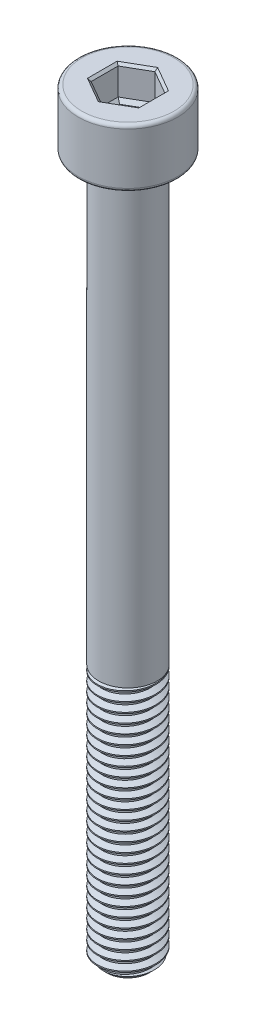
from build123d import *

# Parameters (mm, degrees)
SKETCH1_R           = 2.5
BOSS_EXTRUDE1_DEPTH = 22
THREAD1_PITCH       = 0.8
SKETCH2_R           = 2.5
BOSS_EXTRUDE2_DEPTH = 38
SKETCH3_R           = 4.25
BOSS_EXTRUDE3_DEPTH = 5
FILLET1_R           = 0.3
CUT_EXTRUDE1_DEPTH  = 2.5
CHAMFER1_SIZE       = 0.2
CUT_EXTRUDE2_DEPTH  = 0.3
CUT_EXTRUDE2_DRAFT  = -45


with BuildPart() as part:
    # Sketch1 → Boss-Extrude1 (new body)
    with BuildSketch(Plane(origin=(0, 0, 0), x_dir=(1, 0, 0), z_dir=(0, 1, 0))):
        with Locations(Location((0, 0, 0), (0, 0, 270))):
            Circle(SKETCH1_R)
    extrude(amount=BOSS_EXTRUDE1_DEPTH)

    # Thread1: arcs per turn and ends read off the stored shape
    # Thread1: the profile of Thread Profile1 profile screwed along a right-hand helix through 30 turns, 8 arcs to a turn; built about Z, then put on its axis
    thread1_z = Axis((0, 0, 0), (0, 0, 1))
    thread1_corners = [(2.5003, 0, -0.000173205), (2.5003, 0, 0.700173203), (2.0669873, 0, 0.449999999), (2.0669873, 0, 0.249999999)]
    with BuildLine(mode=Mode.PRIVATE) as thread1_profile:
        Line(thread1_corners[0], thread1_corners[1])
        Line(thread1_corners[1], thread1_corners[2])
        Line(thread1_corners[2], thread1_corners[3])
        Line(thread1_corners[3], thread1_corners[0])
    thread1_cap = Face(thread1_profile.wire())
    thread1_turn_angles = [0, 22.5, 45, 67.5, 90, 112.5, 135, 157.5, 180, 202.5, 225, 247.5, 270, 292.5, 315, 337.5, 360]
    thread1_turn_weights = [1, 0.9238795325112867, 1, 0.9238795325112867, 1, 0.9238795325112867, 1, 0.9238795325112867, 1, 0.9238795325112867, 1, 0.9238795325112867, 1, 0.9238795325112867, 1, 0.9238795325112867, 1]
    thread1_turn_rails = [Edge.make_bspline([Vector(p[0], p[1], 0).rotate(thread1_z, thread1_turn_angles[k]) / thread1_turn_weights[k] + Vector(0, 0, p[2] + THREAD1_PITCH * thread1_turn_angles[k] / 360) for k in range(17)], [0, 0, 0, 1, 1, 2, 2, 3, 3, 4, 4, 5, 5, 6, 6, 7, 7, 8, 8, 8], 2, thread1_turn_weights) for p in thread1_corners]
    thread1_turn_sides = [Face.make_surface_from_curves(thread1_turn_rails[p[0]], thread1_turn_rails[p[1]]) for p in [(0, 1), (1, 2), (2, 3), (3, 0)]]
    thread1 = Plane(origin=(0, 23, 0), x_dir=(-1, 0, 0), z_dir=(0, -1, 0)) * Solid(Shell([*[p.moved(Location((0, 0, THREAD1_PITCH * i))) for i in range(30) for p in thread1_turn_sides], thread1_cap, thread1_cap.rotate(thread1_z, 10800).moved(Location((0, 0, THREAD1_PITCH * 10800 / 360)))]))
    add(thread1, mode=Mode.SUBTRACT)

    # Sketch2 → Boss-Extrude2 (add)
    with BuildSketch(Plane(origin=(0, 22, 0), x_dir=(1, 0, 0), z_dir=(0, 1, 0))):
        with Locations(Location((0, 0, 0), (0, 0, 90))):
            Circle(SKETCH2_R)
    extrude(amount=BOSS_EXTRUDE2_DEPTH)

    # Sketch3 → Boss-Extrude3 (add)
    with BuildSketch(Plane(origin=(0, 60, 0), x_dir=(1, 0, 0), z_dir=(0, 1, 0))):
        with Locations(Location((0, 0, 0), (0, 0, 270))):
            Circle(SKETCH3_R)
    extrude(amount=BOSS_EXTRUDE3_DEPTH)

    # Fillet1
    fillet1_edges = [part.edges().sort_by_distance(p)[0] for p in [
        (0, 60, -4.25),
        (0, 65, -4.25),
    ]]
    fillet(fillet1_edges, radius=FILLET1_R)

    # Sketch4 → Cut-Revolve1 (revolve, cut)
    with BuildSketch(Plane.XY, mode=Mode.PRIVATE) as cut_revolve1_sk:
        Polygon((2.51, 0), (2.51, 0.7), (1.81, 0), align=None)
    revolve(cut_revolve1_sk.sketch.rotate(Axis((0, 0, 0), (0, 1, 0)), 90), axis=Axis((0, 0, 0), (0, 1, 0)), mode=Mode.SUBTRACT)

    # Sketch5 → Cut-Extrude1 (cut)
    with BuildSketch(Plane(origin=(0, 65, 0), x_dir=(1, 0, 0), z_dir=(0, 1, 0))):
        Polygon((0, 2.309401077), (-2, 1.154700538), (-2, -1.154700538), (0, -2.309401077), (2, -1.154700538), (2, 1.154700538), align=None)
    extrude(amount=-CUT_EXTRUDE1_DEPTH, mode=Mode.SUBTRACT)

    # Chamfer1
    chamfer1_edges = [part.edges().sort_by_distance(p)[0] for p in [
        (1, 65, -1.732050808),
        (-1, 65, -1.732050808),
        (-2, 65, 0),
        (-1, 65, 1.732050808),
        (1, 65, 1.732050808),
        (2, 65, 0),
    ]]
    chamfer(chamfer1_edges, length=CHAMFER1_SIZE)


with BuildPart() as cut_extrude2_tool:
    # Sketch6 → Cut-Extrude2 (with draft: the straight prism first)
    with BuildSketch(Plane(origin=(0, 62.5, 0), x_dir=(1, 0, 0), z_dir=(0, 1, 0))):
        Polygon((0, 2.309401077), (-2, 1.154700538), (-2, -1.154700538), (0, -2.309401077), (2, -1.154700538), (2, 1.154700538), align=None)
    extrude(amount=-CUT_EXTRUDE2_DEPTH)
    # Cut-Extrude2: the draft: its side faces are tilted about the plane it starts from
    cut_extrude2_sides = [cut_extrude2_tool.faces().sort_by_distance(p)[0] for p in [
        (-1, 62.35, -1.732050808),
        (-2, 62.35, 0),
        (-1, 62.35, 1.732050808),
        (1, 62.35, 1.732050808),
        (2, 62.35, 0),
        (1, 62.35, -1.732050808),
    ]]
    draft(cut_extrude2_sides, Plane(origin=(0, 62.5, 0), x_dir=(1, 0, 0), z_dir=(0, 1, 0)), CUT_EXTRUDE2_DRAFT)


with BuildPart() as part_1:
    add(part.part)

    # Cut-Extrude2: cut by cut_extrude2_tool
    add(cut_extrude2_tool.part, mode=Mode.SUBTRACT)


solid = part_1.part
